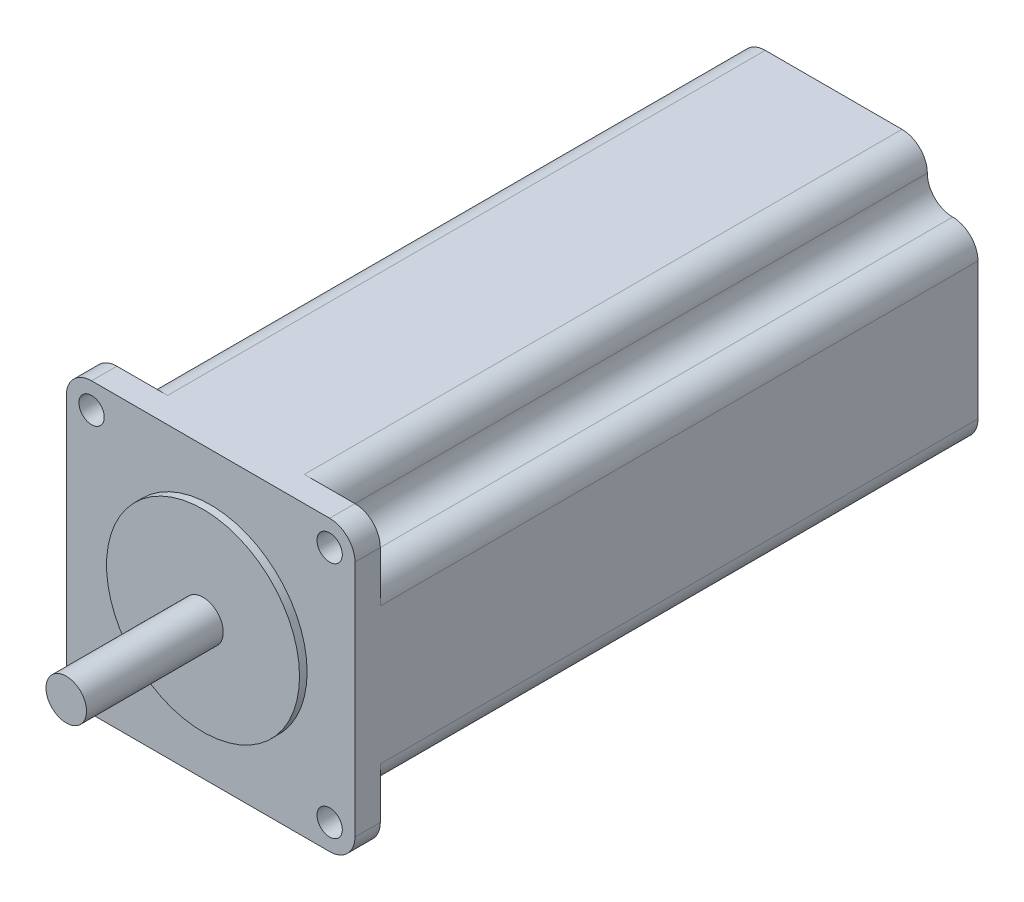
from build123d import *

# Parameters (mm, degrees)
SKETCH1_W            = 57
SKETCH1_H            = 57
BOSS_EXTRUDE1_DEPTH  = 123
SKETCH2_W            = 10
SKETCH2_H            = 10
CUT_EXTRUDE1_DEPTH   = 118
LPATTERN1_COUNT      = 2
LPATTERN1_PITCH      = 47
LPATTERN1_COUNT_DIR2 = 2
LPATTERN1_PITCH_DIR2 = 47
SKETCH3_R            = 2.5
CUT_EXTRUDE2_DEPTH   = 50
LPATTERN2_COUNT      = 2
LPATTERN2_PITCH      = 47
LPATTERN2_COUNT_DIR2 = 2
LPATTERN2_PITCH_DIR2 = 47
FILLET1_R            = 5
SKETCH5_R            = 19.05
BOSS_EXTRUDE3_DEPTH  = 1.5
SKETCH4_R            = 4
BOSS_EXTRUDE2_DEPTH  = 28.5


with BuildPart() as part:
    # Sketch1 → Boss-Extrude1 (new body)
    with BuildSketch(Plane.XY):
        with Locations((-4.861204013, 2.764214047)):
            Rectangle(SKETCH1_W, SKETCH1_H)
    extrude(amount=BOSS_EXTRUDE1_DEPTH)

    # Sketch2 → Cut-Extrude1 (cut)
    with BuildSketch(Plane(origin=(0, 0, 0), x_dir=(-1, 0, 0), z_dir=(0, 0, -1))):
        with Locations((-18.638795987, 26.264214047)):
            Rectangle(SKETCH2_W, SKETCH2_H)
    cut_extrude1 = extrude(amount=-CUT_EXTRUDE1_DEPTH, mode=Mode.SUBTRACT)

    # LPattern1: Cut-Extrude1 2 × 2
    with Locations(*[(-i * LPATTERN1_PITCH, -j * LPATTERN1_PITCH_DIR2, 0) for i in range(LPATTERN1_COUNT) for j in range(LPATTERN1_COUNT_DIR2) if (i, j) != (0, 0)]):
        add(cut_extrude1, mode=Mode.SUBTRACT)

    # Sketch3 → Cut-Extrude2 (cut)
    with BuildSketch(Plane.XY.offset(123)):
        with Locations((-28.361204013, 26.264214047)):
            Circle(SKETCH3_R)
    cut_extrude2 = extrude(amount=-CUT_EXTRUDE2_DEPTH, mode=Mode.SUBTRACT)

    # LPattern2: Cut-Extrude2 2 × 2
    with Locations(*[(i * LPATTERN2_PITCH, -j * LPATTERN2_PITCH_DIR2, 0) for i in range(LPATTERN2_COUNT) for j in range(LPATTERN2_COUNT_DIR2) if (i, j) != (0, 0)]):
        add(cut_extrude2, mode=Mode.SUBTRACT)

    # Fillet1
    fillet1_edges = [part.edges().sort_by_distance(p)[0] for p in [
        (-33.361204013, 21.264214047, 59),
        (-23.361204013, 21.264214047, 59),
        (-23.361204013, 31.264214047, 59),
        (13.638795987, 31.264214047, 59),
        (13.638795987, 21.264214047, 59),
        (23.638795987, 21.264214047, 59),
        (23.638795987, -25.735785953, 120.5),
        (23.638795987, -15.735785953, 59),
        (13.638795987, -15.735785953, 59),
        (13.638795987, -25.735785953, 59),
        (-23.361204013, -25.735785953, 59),
        (-23.361204013, -15.735785953, 59),
        (-33.361204013, -15.735785953, 59),
        (-33.361204013, -25.735785953, 120.5),
        (-33.361204013, 31.264214047, 120.5),
        (23.638795987, 31.264214047, 120.5),
    ]]
    fillet(fillet1_edges, radius=FILLET1_R - 0.0001)  # a hair under: the kernel refuses the full size

    # Sketch5 → Boss-Extrude3 (add)
    with BuildSketch(Plane.XY.offset(123)):
        with Locations((-4.861204013, 2.764214047)):
            Circle(SKETCH5_R)
    extrude(amount=BOSS_EXTRUDE3_DEPTH)

    # Sketch4 → Boss-Extrude2 (add)
    with BuildSketch(Plane.XY.offset(123)):
        with Locations(Location((-4.861204013, 2.764214047, 0), (0, 0, 180))):
            Circle(SKETCH4_R)
    extrude(amount=BOSS_EXTRUDE2_DEPTH)


solid = part.part
